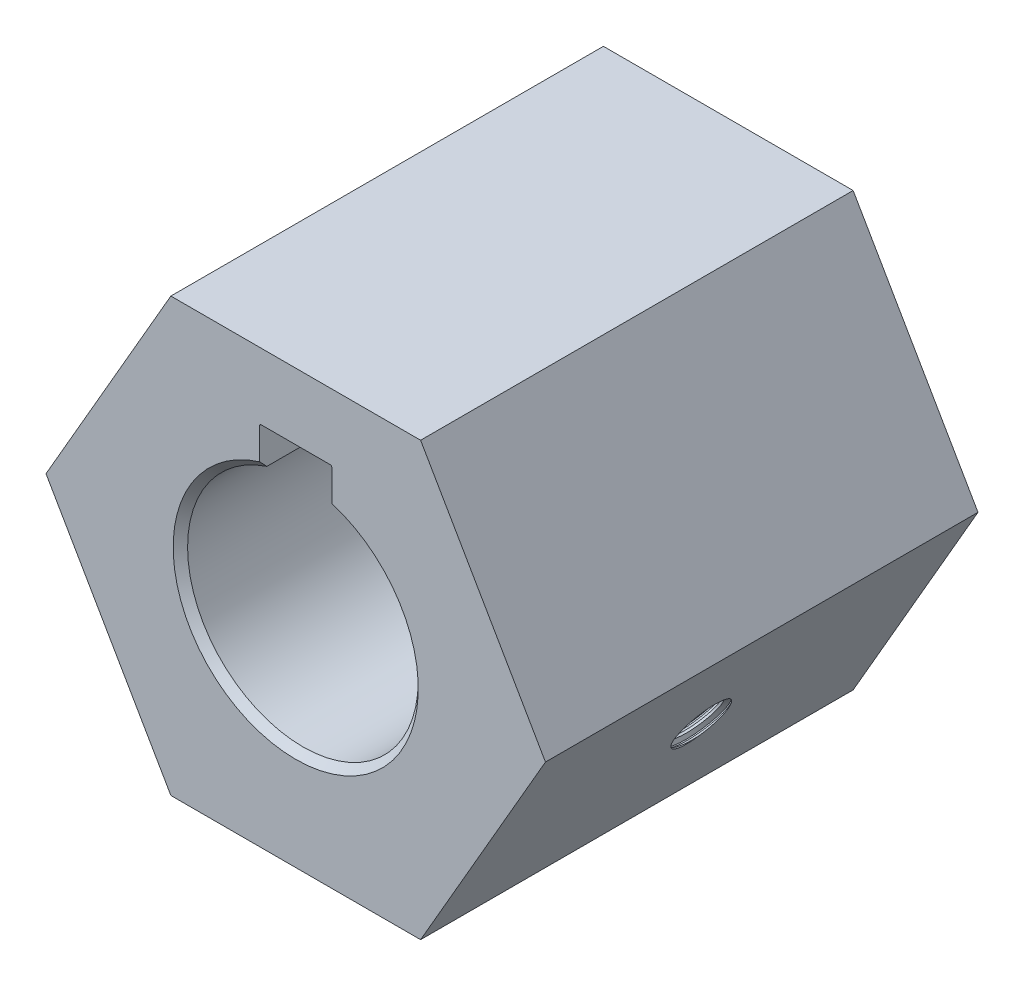
from build123d import *

# Parameters (mm, degrees)
BOSS_EXTRUDE1_DEPTH             = 30
CUT_EXTRUDE1_DEPTH              = 38.749172176
SKETCH3_W                       = 8
SKETCH3_H                       = 30
F_4_2_4_2_DIAMETER_HOLE1_REACH  = 39.749
F_4_2_4_2_DIAMETER_HOLE1_BORE_R = 2.1
CHAMFER1_SIZE                   = 0.5
FILLET1_R                       = 0.1
CHAMFER2_SIZE                   = 1.15
SKETCH6_R                       = 1.75
CUT_EXTRUDE2_DEPTH              = 4.8777
THREAD1_PITCH                   = 0.6
THREAD1_TO                      = 5.8777
CUT_EXTRUDE3_START              = -4.8777
SKETCH9_R                       = 1.75
CUT_EXTRUDE3_DEPTH              = 4.8777
THREAD2_PITCH                   = 0.6
THREAD2_TO                      = 5.8777


with BuildPart() as part:
    # Sketch1 → Boss-Extrude1 (new body)
    with BuildSketch(Plane(origin=(0, 0, -15), x_dir=(-1, 0, 0), z_dir=(0, 0, -1))):
        Polygon((-8.660254038, 15), (-17.320508076, 0), (-8.660254038, -15), (8.660254038, -15), (17.320508076, 0), (8.660254038, 15), align=None)
    extrude(amount=-BOSS_EXTRUDE1_DEPTH)

    # Sketch2 → Cut-Extrude1 (cut, through all)
    with BuildSketch(Plane.XY.offset(15)):
        with BuildLine():
            Line((-2.5, 10.4), (-2.5, 7.599342077))
            ThreePointArc((-2.5, 7.599342077), (0, 8), (2.5, 7.599342077))
            Line((2.5, 7.599342077), (2.5, 10.4))
            Line((2.5, 10.4), (-2.5, 10.4))
        make_face()
    extrude(amount=-CUT_EXTRUDE1_DEPTH, mode=Mode.SUBTRACT)

    # Sketch3 → Cut-Revolve1 (revolve, cut)
    with BuildSketch(Plane.XZ):
        with Locations((4, 0)):
            Rectangle(SKETCH3_W, SKETCH3_H)
    revolve(axis=Axis((0, 0, 15), (0, 0, -1)), mode=Mode.SUBTRACT)

    # Ø4.2 (4.2) Diameter Hole1 bore → Ø4.2 (4.2) Diameter Hole1 (cut, up to next)
    with BuildSketch(Plane(origin=(0, -15, 0), x_dir=(-1, 0, 0), z_dir=(0, -1, 0)), mode=Mode.PRIVATE) as f_4_2_4_2_diameter_hole1_sk1:
        with Locations((0, 5)):
            Circle(F_4_2_4_2_DIAMETER_HOLE1_BORE_R)
    f_4_2_4_2_diameter_hole1_tool1 = extrude(f_4_2_4_2_diameter_hole1_sk1.sketch, amount=-F_4_2_4_2_DIAMETER_HOLE1_REACH, mode=Mode.PRIVATE) & part.part
    add(f_4_2_4_2_diameter_hole1_tool1.solids().sort_by_distance((0, -15, -5))[0], mode=Mode.SUBTRACT)

    # Chamfer1
    chamfer1_edges = [part.edges().sort_by_distance(p)[0] for p in [
        (0, -8, 15),
        (0, -8, -15),
    ]]
    chamfer(chamfer1_edges, length=CHAMFER1_SIZE)

    # Fillet1
    fillet1_edges = [part.edges().sort_by_distance(p)[0] for p in [
        (-2.5, 10.4, 0),
        (2.5, 10.4, 0),
    ]]
    fillet(fillet1_edges, radius=FILLET1_R)

    # Chamfer2
    chamfer2_edges = [part.edges().sort_by_distance(p)[0] for p in [
        (2.1, -15, -5),
    ]]
    chamfer(chamfer2_edges, length=CHAMFER2_SIZE)

    # Sketch6 → Cut-Extrude2 (cut)
    with BuildSketch(Plane(origin=(-12.990381057, 7.5, 0), x_dir=(0, 0, 1), z_dir=(-0.8660254037844393, 0.499999999999999, 0))):
        with Locations(Location((0, 0, 0), (0, 0, 270))):
            Circle(SKETCH6_R)
    extrude(amount=-CUT_EXTRUDE2_DEPTH, mode=Mode.SUBTRACT)

    # Thread1: arcs per turn and ends read off the stored shape
    # Thread1: the profile of Thread Profile1 profile screwed along a right-hand helix through 9.796167 turns, 6 arcs to a turn; built about Z, then put on its axis
    thread1_z = Axis((0, 0, 0), (0, 0, 1))
    thread1_corners = [(1.7497, 0, -0.000173205), (2.074759525, 0, 0.1875), (2.074759525, 0, 0.2625), (1.7497, 0, 0.450173204)]
    with BuildLine(mode=Mode.PRIVATE) as thread1_profile:
        Line(thread1_corners[0], thread1_corners[1])
        Line(thread1_corners[1], thread1_corners[2])
        Line(thread1_corners[2], thread1_corners[3])
        Line(thread1_corners[3], thread1_corners[0])
    thread1_cap = Face(thread1_profile.wire())
    thread1_turn_angles = [0, 30, 60, 90, 120, 150, 180, 210, 240, 270, 300, 330, 360]
    thread1_turn_weights = [1, 0.8660254037844387, 1, 0.8660254037844387, 1, 0.8660254037844387, 1, 0.8660254037844387, 1, 0.8660254037844387, 1, 0.8660254037844387, 1]
    thread1_turn_rails = [Edge.make_bspline([Vector(p[0], p[1], 0).rotate(thread1_z, thread1_turn_angles[k]) / thread1_turn_weights[k] + Vector(0, 0, p[2] + THREAD1_PITCH * thread1_turn_angles[k] / 360) for k in range(13)], [0, 0, 0, 1, 1, 2, 2, 3, 3, 4, 4, 5, 5, 6, 6, 6], 2, thread1_turn_weights) for p in thread1_corners]
    thread1_turn_sides = [Face.make_surface_from_curves(thread1_turn_rails[p[0]], thread1_turn_rails[p[1]]) for p in [(0, 1), (1, 2), (2, 3), (3, 0)]]
    thread1_last_angles = [3240, 3270, 3300, 3330, 3360, 3390, 3420, 3450, 3480, 3503.31, 3526.62]
    thread1_last_weights = [1, 0.8660254037844387, 1, 0.8660254037844387, 1, 0.8660254037844387, 1, 0.8660254037844387, 1, 0.918377331641091, 1]
    thread1_last_rails = [Edge.make_bspline([Vector(p[0], p[1], 0).rotate(thread1_z, thread1_last_angles[k]) / thread1_last_weights[k] + Vector(0, 0, p[2] + THREAD1_PITCH * thread1_last_angles[k] / 360) for k in range(11)], [0, 0, 0, 1, 1, 2, 2, 3, 3, 4, 4, 5, 5, 5], 2, thread1_last_weights) for p in thread1_corners]
    thread1_last_sides = [Face.make_surface_from_curves(thread1_last_rails[p[0]], thread1_last_rails[p[1]]) for p in [(0, 1), (1, 2), (2, 3), (3, 0)]]
    thread1 = Plane(origin=(-13.856406461, 8, 0), x_dir=(0, 0, -1), z_dir=(0.866025404, -0.5, 0)) * split(Solid(Shell([*[p.moved(Location((0, 0, THREAD1_PITCH * i))) for i in range(9) for p in thread1_turn_sides], *thread1_last_sides, thread1_cap, thread1_cap.rotate(thread1_z, 3526.62).moved(Location((0, 0, THREAD1_PITCH * 3526.62 / 360)))])), bisect_by=Plane.XY.offset(THREAD1_TO), keep=Keep.BOTTOM, mode=Mode.PRIVATE)
    add(thread1, mode=Mode.SUBTRACT)

    # Sketch9 → Cut-Extrude3 (cut)
    with BuildSketch(Plane(origin=(12.990381057, -7.5, 0), x_dir=(0, 0, -1), z_dir=(0.866025403784439, -0.4999999999999995, 0)).offset(CUT_EXTRUDE3_START)):
        with Locations(Location((0, 0, 0), (0, 0, 90))):
            Circle(SKETCH9_R)
    extrude(amount=CUT_EXTRUDE3_DEPTH, mode=Mode.SUBTRACT)

    # Thread2: arcs per turn and ends read off the stored shape
    # Thread2: the profile of Thread Profile2 profile screwed along a right-hand helix through 9.796167 turns, 6 arcs to a turn; built about Z, then put on its axis
    thread2_z = Axis((0, 0, 0), (0, 0, 1))
    thread2_corners = [(1.7497, 0, -0.000173205), (2.074759525, 0, 0.1875), (2.074759525, 0, 0.2625), (1.7497, 0, 0.450173204)]
    with BuildLine(mode=Mode.PRIVATE) as thread2_profile:
        Line(thread2_corners[0], thread2_corners[1])
        Line(thread2_corners[1], thread2_corners[2])
        Line(thread2_corners[2], thread2_corners[3])
        Line(thread2_corners[3], thread2_corners[0])
    thread2_cap = Face(thread2_profile.wire())
    thread2_turn_angles = [0, 30, 60, 90, 120, 150, 180, 210, 240, 270, 300, 330, 360]
    thread2_turn_weights = [1, 0.8660254037844387, 1, 0.8660254037844387, 1, 0.8660254037844387, 1, 0.8660254037844387, 1, 0.8660254037844387, 1, 0.8660254037844387, 1]
    thread2_turn_rails = [Edge.make_bspline([Vector(p[0], p[1], 0).rotate(thread2_z, thread2_turn_angles[k]) / thread2_turn_weights[k] + Vector(0, 0, p[2] + THREAD2_PITCH * thread2_turn_angles[k] / 360) for k in range(13)], [0, 0, 0, 1, 1, 2, 2, 3, 3, 4, 4, 5, 5, 6, 6, 6], 2, thread2_turn_weights) for p in thread2_corners]
    thread2_turn_sides = [Face.make_surface_from_curves(thread2_turn_rails[p[0]], thread2_turn_rails[p[1]]) for p in [(0, 1), (1, 2), (2, 3), (3, 0)]]
    thread2_last_angles = [3240, 3270, 3300, 3330, 3360, 3390, 3420, 3450, 3480, 3503.31, 3526.62]
    thread2_last_weights = [1, 0.8660254037844387, 1, 0.8660254037844387, 1, 0.8660254037844387, 1, 0.8660254037844387, 1, 0.9183773316410833, 1]
    thread2_last_rails = [Edge.make_bspline([Vector(p[0], p[1], 0).rotate(thread2_z, thread2_last_angles[k]) / thread2_last_weights[k] + Vector(0, 0, p[2] + THREAD2_PITCH * thread2_last_angles[k] / 360) for k in range(11)], [0, 0, 0, 1, 1, 2, 2, 3, 3, 4, 4, 5, 5, 5], 2, thread2_last_weights) for p in thread2_corners]
    thread2_last_sides = [Face.make_surface_from_curves(thread2_last_rails[p[0]], thread2_last_rails[p[1]]) for p in [(0, 1), (1, 2), (2, 3), (3, 0)]]
    thread2 = Plane(origin=(13.856406461, -8, 0), x_dir=(0, 0, 1), z_dir=(-0.866025404, 0.5, 0)) * split(Solid(Shell([*[p.moved(Location((0, 0, THREAD2_PITCH * i))) for i in range(9) for p in thread2_turn_sides], *thread2_last_sides, thread2_cap, thread2_cap.rotate(thread2_z, 3526.62).moved(Location((0, 0, THREAD2_PITCH * 3526.62 / 360)))])), bisect_by=Plane.XY.offset(THREAD2_TO), keep=Keep.BOTTOM, mode=Mode.PRIVATE)
    add(thread2, mode=Mode.SUBTRACT)


solid = part.part
